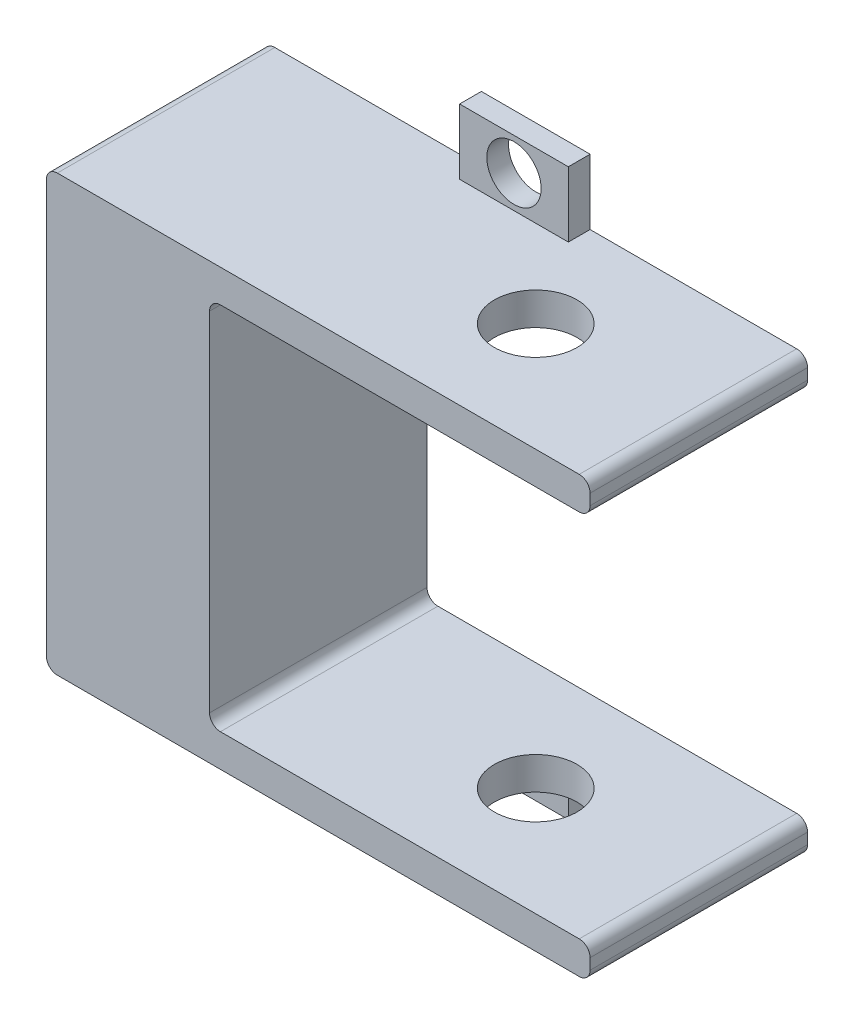
from build123d import *

# Parameters (mm, degrees)
SKETCH1_W           = 63.5
SKETCH1_H           = 50.8
BOSS_EXTRUDE1_DEPTH = 25.4
SKETCH3_W           = 44.45
SKETCH3_H           = 43.18
CUT_EXTRUDE1_DEPTH  = 38.1
SKETCH5_R           = 4.826
CUT_EXTRUDE2_DEPTH  = 76.2
FILLET3_R           = 1.27
SKETCH10_W          = 12.7
SKETCH10_H          = 2.54
BOSS_EXTRUDE4_DEPTH = 7.62
SKETCH11_W          = 12.7
SKETCH11_H          = 2.54
BOSS_EXTRUDE5_DEPTH = 7.62
CUT_EXTRUDE5_REACH  = 91.262
SKETCH12_R          = 3.175
SKETCH13_W          = 5.08
SKETCH13_H          = 5.08
BOSS_EXTRUDE6_DEPTH = 6.35
CUT_EXTRUDE6_REACH  = 83.876
SKETCH15_R          = 1.905
FILLET5_R           = 2.54


with BuildPart() as part:
    # Sketch1 → Boss-Extrude1 (new body)
    with BuildSketch(Plane.XY):
        with Locations((31.75, 25.4)):
            Rectangle(SKETCH1_W, SKETCH1_H)
    extrude(amount=BOSS_EXTRUDE1_DEPTH)

    # Sketch3 → Cut-Extrude1 (cut)
    with BuildSketch(Plane(origin=(0, 0, 0), x_dir=(-1, 0, 0), z_dir=(0, 0, -1))):
        with Locations((-41.275, 25.4)):
            Rectangle(SKETCH3_W, SKETCH3_H)
    extrude(amount=-CUT_EXTRUDE1_DEPTH, mode=Mode.SUBTRACT)

    # Sketch5 → Cut-Extrude2 (cut)
    with BuildSketch(Plane.XZ):
        with Locations(Location((44.45, 12.7, 0), (0, 0, 270))):
            Circle(SKETCH5_R)
    extrude(amount=-CUT_EXTRUDE2_DEPTH, mode=Mode.SUBTRACT)

    # Fillet3
    fillet3_edges = [part.edges().sort_by_distance(p)[0] for p in [
        (63.5, 3.81, 12.7),
        (63.5, 46.99, 12.7),
        (19.05, 46.99, 12.7),
        (19.05, 3.81, 12.7),
        (0, 50.8, 12.7),
        (63.5, 50.8, 12.7),
        (63.5, 0, 12.7),
        (0, 0, 12.7),
    ]]
    fillet(fillet3_edges, radius=FILLET3_R)

    # Sketch10 → Boss-Extrude4 (add)
    with BuildSketch(Plane.XZ):
        with Locations((31.75, 1.27)):
            Rectangle(SKETCH10_W, SKETCH10_H)
    extrude(amount=BOSS_EXTRUDE4_DEPTH)

    # Sketch11 → Boss-Extrude5 (add)
    with BuildSketch(Plane(origin=(0, 50.8, 0), x_dir=(1, 0, 0), z_dir=(0, 1, 0))):
        with Locations((31.75, -1.27)):
            Rectangle(SKETCH11_W, SKETCH11_H)
    extrude(amount=BOSS_EXTRUDE5_DEPTH)

    # Sketch12 → Cut-Extrude5 (cut, up to next)
    with BuildSketch(Plane.XY.offset(2.54), mode=Mode.PRIVATE) as cut_extrude5_sk1:
        with Locations((31.75, 54.61)):
            Circle(SKETCH12_R)
    cut_extrude5_tool1 = extrude(cut_extrude5_sk1.sketch, amount=-CUT_EXTRUDE5_REACH, mode=Mode.PRIVATE) & part.part
    # Sketch12 → Cut-Extrude5 (cut, up to next)
    with BuildSketch(Plane.XY.offset(2.54), mode=Mode.PRIVATE) as cut_extrude5_sk2:
        with Locations((31.75, -3.81)):
            Circle(SKETCH12_R)
    cut_extrude5_tool2 = extrude(cut_extrude5_sk2.sketch, amount=-CUT_EXTRUDE5_REACH, mode=Mode.PRIVATE) & part.part
    add(cut_extrude5_tool1.solids().sort_by_distance((31.75, 54.61, 2.54))[0], mode=Mode.SUBTRACT)
    add(cut_extrude5_tool2.solids().sort_by_distance((31.75, -3.81, 2.54))[0], mode=Mode.SUBTRACT)

    # Sketch13 → Boss-Extrude6 (add)
    with BuildSketch(Plane(origin=(0, 0, 0), x_dir=(-1, 0, 0), z_dir=(0, 0, -1))):
        with Locations((-9.525, 25.4)):
            Rectangle(SKETCH13_W, SKETCH13_H)
    extrude(amount=BOSS_EXTRUDE6_DEPTH)

    # Sketch15 → Cut-Extrude6 (cut, up to next)
    with BuildSketch(Plane(origin=(12.065, 0, 0), x_dir=(0, 0, -1), z_dir=(1, 0, 0)), mode=Mode.PRIVATE) as cut_extrude6_sk1:
        with Locations((3.175, 25.4)):
            Circle(SKETCH15_R)
    cut_extrude6_tool1 = extrude(cut_extrude6_sk1.sketch, amount=-CUT_EXTRUDE6_REACH, mode=Mode.PRIVATE) & part.part
    add(cut_extrude6_tool1.solids().sort_by_distance((12.065, 25.4, -3.175))[0], mode=Mode.SUBTRACT)

    # Fillet5
    fillet5_edges = [part.edges().sort_by_distance(p)[0] for p in [
        (9.525, 27.94, -6.35),
        (9.525, 22.86, -6.35),
    ]]
    fillet(fillet5_edges, radius=FILLET5_R - 0.0001)  # a hair under: the kernel refuses the full size


solid = part.part
